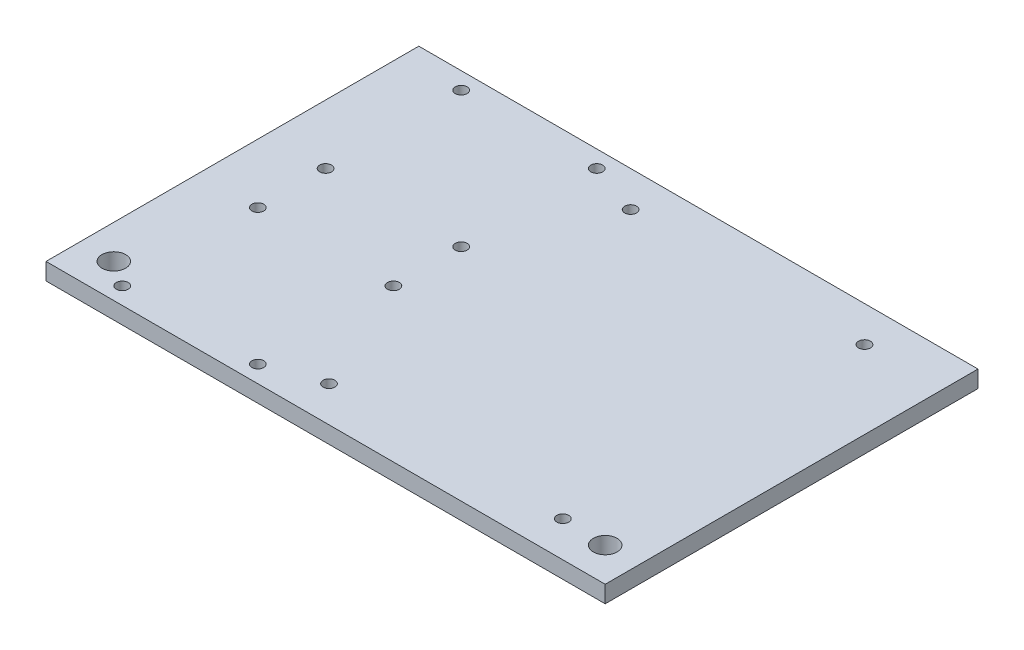
from build123d import *

# Parameters (mm, degrees)
SKETCH1_W           = 165
SKETCH1_H           = 110
SKETCH1_R           = 3.5
SKETCH1_R_2         = 1.75
BOSS_EXTRUDE1_DEPTH = 5


with BuildPart() as part:
    # Sketch1 → Boss-Extrude1 (new body)
    with BuildSketch(Plane(origin=(0, 0, 0), x_dir=(1, 0, 0), z_dir=(0, 1, 0))):
        Rectangle(SKETCH1_W, SKETCH1_H)
        with Locations((72.5, -45)):
            Circle(SKETCH1_R, mode=Mode.SUBTRACT)
        with Locations((-72.5, -45)):
            Circle(SKETCH1_R, mode=Mode.SUBTRACT)
        with Locations((59.5, -44.5)):
            Circle(SKETCH1_R_2, mode=Mode.SUBTRACT)
        with Locations((-9.5, -44.5)):
            Circle(SKETCH1_R_2, mode=Mode.SUBTRACT)
        with Locations((-25, -50)):
            Circle(SKETCH1_R_2, mode=Mode.SUBTRACT)
        with Locations((-65, -50)):
            Circle(SKETCH1_R_2, mode=Mode.SUBTRACT)
        with Locations((-65, -10)):
            Circle(SKETCH1_R_2, mode=Mode.SUBTRACT)
        with Locations((-25, -10)):
            Circle(SKETCH1_R_2, mode=Mode.SUBTRACT)
        with Locations((-65, 10)):
            Circle(SKETCH1_R_2, mode=Mode.SUBTRACT)
        with Locations((-25, 10)):
            Circle(SKETCH1_R_2, mode=Mode.SUBTRACT)
        with Locations((-65, 50)):
            Circle(SKETCH1_R_2, mode=Mode.SUBTRACT)
        with Locations((-25, 50)):
            Circle(SKETCH1_R_2, mode=Mode.SUBTRACT)
        with Locations((-9.5, 44.5)):
            Circle(SKETCH1_R_2, mode=Mode.SUBTRACT)
        with Locations((59.5, 44.5)):
            Circle(SKETCH1_R_2, mode=Mode.SUBTRACT)
    extrude(amount=BOSS_EXTRUDE1_DEPTH)


solid = part.part
